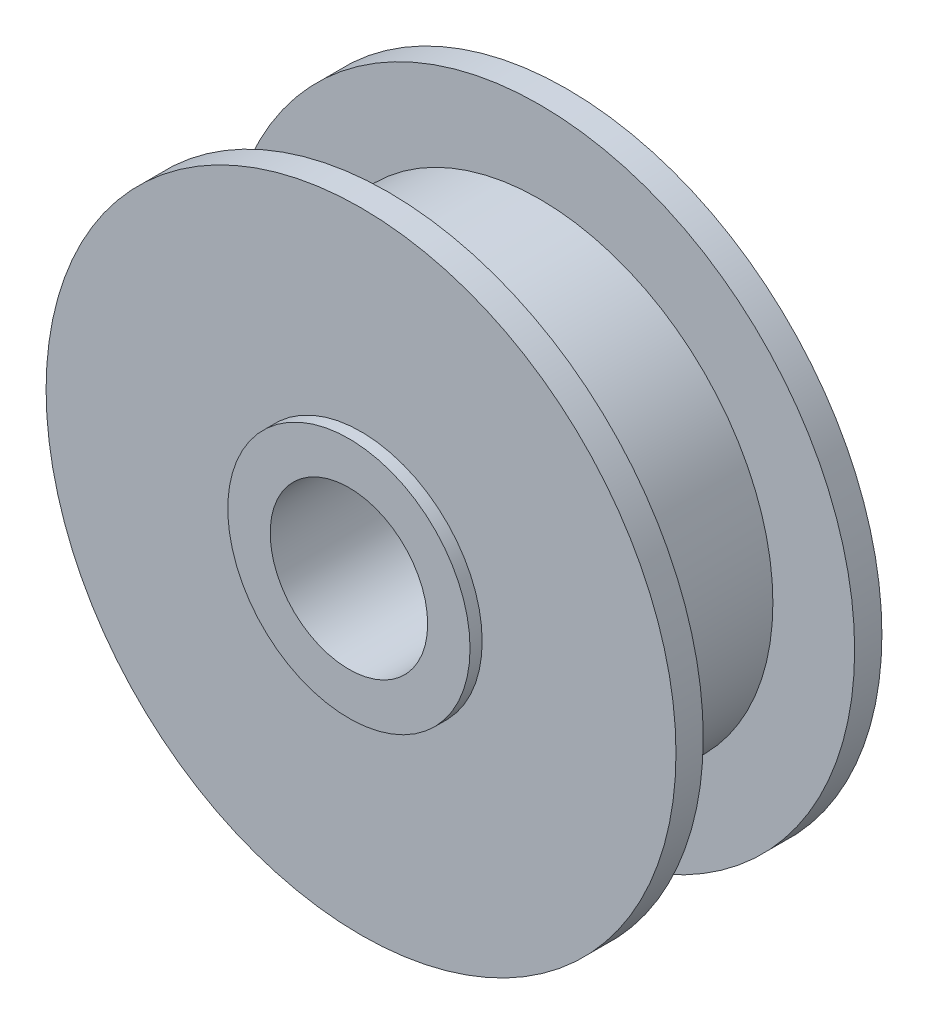
from build123d import *


with BuildPart() as part:
    # Sketch1 → Revolve1 (revolve)
    with BuildSketch(Plane(origin=(0, 0, 0), x_dir=(0, 0, -1), z_dir=(1, 0, 0))):
        Polygon((0, 1.3), (0, 2), (0.2, 2), (0.2, 5.2), (0.65, 5.2), (0.65, 3.85), (3.15, 3.85), (3.15, 5.2), (3.6, 5.2), (3.6, 2), (3.8, 2), (3.8, 1.3), align=None)
    revolve(axis=Axis((0, 0, 0), (0, 0, -1)))


solid = part.part
